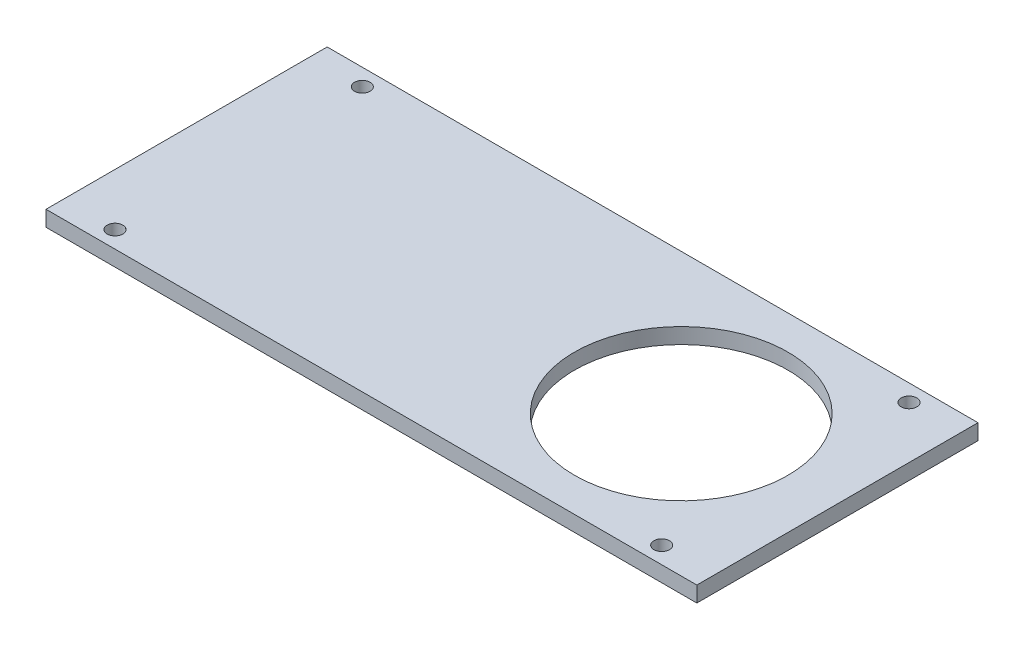
from build123d import *

# Parameters (mm, degrees)
SKETCH_1_W          = 250
SKETCH_1_H          = 108
SKETCH_1_R          = 41
EXTRUDE_1_DEPTH     = 6
SKETCH_2_R          = 3
CUT_EXTRUDE_1_DEPTH = 137.297468795


with BuildPart() as part:
    # Эскиз1 → Бобышка-Вытянуть1 (new body)
    with BuildSketch(Plane(origin=(0, 0, 0), x_dir=(1, 0, 0), z_dir=(0, 1, 0))):
        Rectangle(SKETCH_1_W, SKETCH_1_H)
        with Locations((65, 0)):
            Circle(SKETCH_1_R, mode=Mode.SUBTRACT)
    extrude(amount=EXTRUDE_1_DEPTH)

    # Эскиз2 → Вырез-Вытянуть1 (cut, through all)
    with BuildSketch(Plane(origin=(0, 6, 0), x_dir=(1, 0, 0), z_dir=(0, 1, 0))):
        with Locations((-105, -47.5)):
            Circle(SKETCH_2_R)
        with Locations((-105, 47.5)):
            Circle(SKETCH_2_R)
        with Locations((105, 47.5)):
            Circle(SKETCH_2_R)
        with Locations((105, -47.5)):
            Circle(SKETCH_2_R)
    extrude(amount=-CUT_EXTRUDE_1_DEPTH, mode=Mode.SUBTRACT)


solid = part.part
